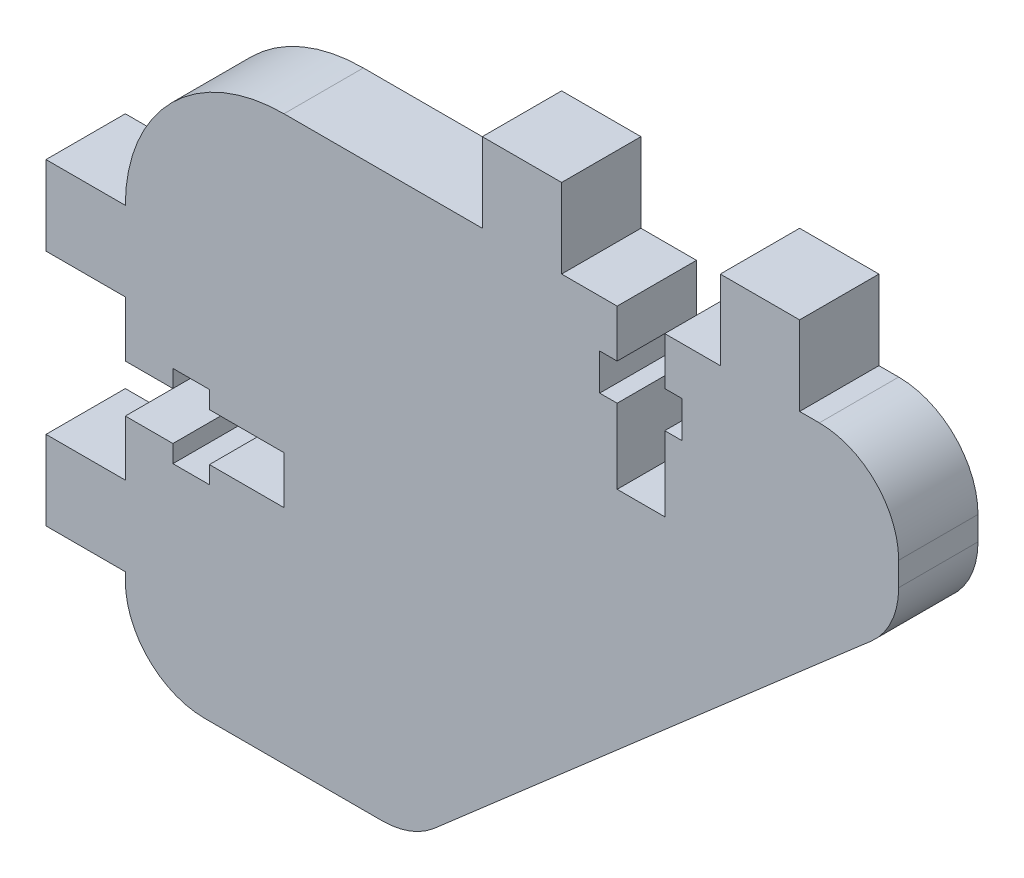
from build123d import *

# Parameters (mm, degrees)
BOSS_EXTRUDE1_DEPTH = 5
FILLET1_R           = 10
FILLET2_R           = 5


with BuildPart() as part:
    # Sketch1 → Boss-Extrude1 (new body)
    with BuildSketch(Plane.XY):
        Polygon((-92.5, 96.5), (-92.5, 100), (-97.5, 100), (-97.5, 105), (-92.5, 105), (-92.5, 115), (-70, 115), (-70, 120), (-65, 120), (-65, 115), (-61.5, 115), (-61.5, 112), (-62.6, 112), (-62.6, 109.7), (-61.5, 109.7), (-61.5, 105), (-58.5, 105), (-58.5, 109.7), (-57.4, 109.7), (-57.4, 112), (-58.5, 112), (-58.5, 115), (-55, 115), (-55, 120), (-50, 120), (-50, 115), (-43.75587644, 115), (-43.75587644, 106.227080611), (-74.442868217, 79.497668649), (-92.5, 79.497668649), (-92.5, 85), (-97.5, 85), (-97.5, 90), (-92.5, 90), (-92.5, 93.5), (-89.5, 93.5), (-89.5, 92.4), (-87.2, 92.4), (-87.2, 93.5), (-82.5, 93.5), (-82.5, 96.5), (-87.2, 96.5), (-87.2, 97.6), (-89.5, 97.6), (-89.5, 96.5), align=None)
    extrude(amount=BOSS_EXTRUDE1_DEPTH)

    # Fillet1
    fillet1_edges = [part.edges().sort_by_distance(p)[0] for p in [
        (-92.5, 115, 2.5),
    ]]
    fillet(fillet1_edges, radius=FILLET1_R - 0.0001)  # a hair under: the kernel refuses the full size

    # Fillet2
    fillet2_edges = [part.edges().sort_by_distance(p)[0] for p in [
        (-43.75587644, 115, 2.5),
        (-43.75587644, 106.227080611, 2.5),
        (-74.442868217, 79.497668649, 2.5),
        (-92.5, 79.497668649, 2.5),
    ]]
    fillet(fillet2_edges, radius=FILLET2_R)


solid = part.part
